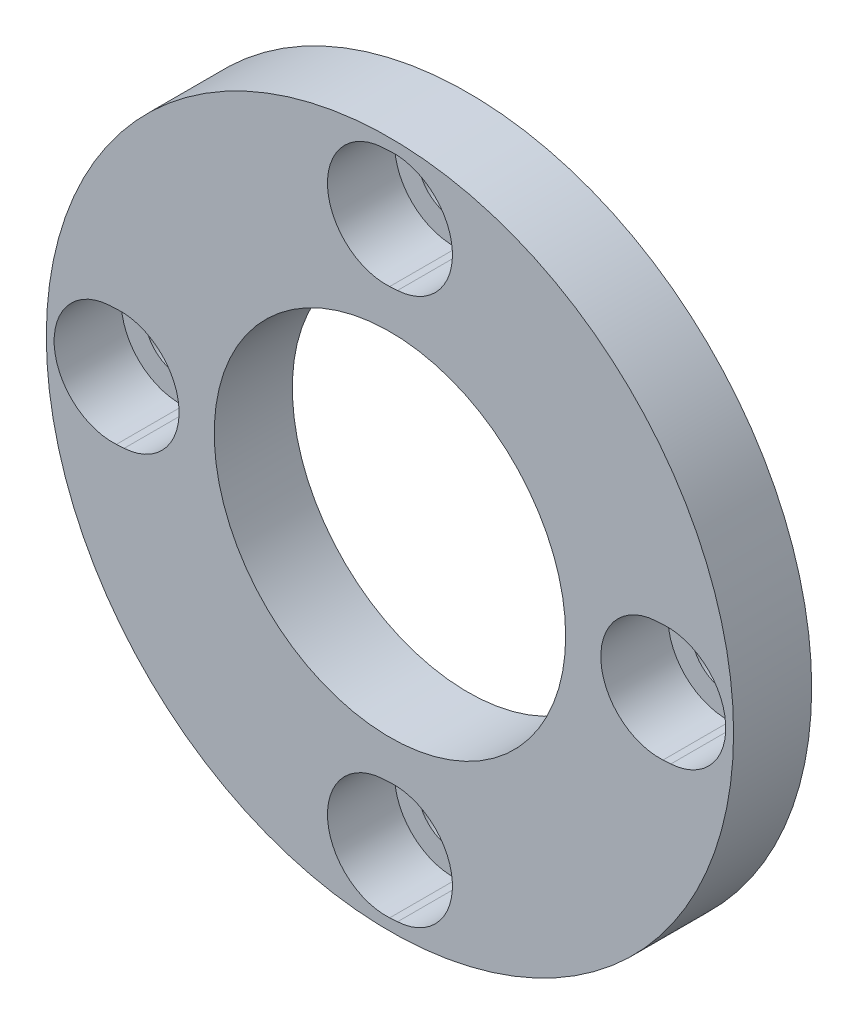
from build123d import *

# Parameters (mm, degrees)
IZIM1_R                                     = 44
IZIM1_R_2                                   = 22.5
Y_KSEKLIK_EKSTR_ZYON1_DEPTH                 = 10
M8_START                                    = 1.4
M8_ALT_GEN_ALYAN_BA_L_K_R_VIDA_IN_HAV_DEPTH = 8.6
M8_ALT_GEN_ALYAN_BA_L_K_R_VIDA_IN_3_DEPTH   = 1.4


# Read off the part's stored shape, not the designer's step: M8 Altıgen Alyan Başlı Kör Vida İçin Havşa1
with BuildPart() as part:
    # Çizim1 → Yükseklik-Ekstrüzyon1 (new body)
    with BuildSketch(Plane.XY):
        Circle(IZIM1_R)
        Circle(IZIM1_R_2, mode=Mode.SUBTRACT)
    extrude(amount=Y_KSEKLIK_EKSTR_ZYON1_DEPTH)

    # M8 Alt_gen Alyan Ba_l_ K_r Vida _in  2 → M8 Altıgen Alyan Başlı Kör Vida İçin Havşa1 (cut)
    with BuildSketch(Plane.XY.offset(M8_START)):
        with BuildLine():
            Line((-35.031641101, -7.516581593), (-34.033584774, -7.454263318))
            ThreePointArc((-34.033584774, -7.454263318), (-27.015549381, 0.4985462), (-34.968358899, 7.516581593))
            Line((-34.968358899, 7.516581593), (-35.966415226, 7.454263318))
            ThreePointArc((-35.966415226, 7.454263318), (-42.984450619, -0.4985462), (-35.031641101, -7.516581593))
        make_face()
        with BuildLine():
            Line((-0.031641101, -42.516581593), (0.966415226, -42.454263318))
            ThreePointArc((0.966415226, -42.454263318), (7.984450619, -34.5014538), (0.031641101, -27.483418407))
            Line((0.031641101, -27.483418407), (-0.966415226, -27.545736682))
            ThreePointArc((-0.966415226, -27.545736682), (-7.984450619, -35.4985462), (-0.031641101, -42.516581593))
        make_face()
        with BuildLine():
            Line((34.968358899, -7.516581593), (35.966415226, -7.454263318))
            ThreePointArc((35.966415226, -7.454263318), (42.984450619, 0.4985462), (35.031641101, 7.516581593))
            Line((35.031641101, 7.516581593), (34.033584774, 7.454263318))
            ThreePointArc((34.033584774, 7.454263318), (27.015549381, -0.4985462), (34.968358899, -7.516581593))
        make_face()
        with BuildLine():
            Line((-0.031641101, 27.483418407), (0.966415226, 27.545736682))
            ThreePointArc((0.966415226, 27.545736682), (7.984450619, 35.4985462), (0.031641101, 42.516581593))
            Line((0.031641101, 42.516581593), (-0.966415226, 42.454263318))
            ThreePointArc((-0.966415226, 42.454263318), (-7.984450619, 34.5014538), (-0.031641101, 27.483418407))
        make_face()
    extrude(amount=M8_ALT_GEN_ALYAN_BA_L_K_R_VIDA_IN_HAV_DEPTH, mode=Mode.SUBTRACT)

    # M8 Alt_gen Alyan Ba_l_ K_r Vida _in 3 ou → M8 Alt_gen Alyan Ba_l_ K_r Vida _in  3 (cut)
    with BuildSketch(Plane.XY):
        with BuildLine():
            Line((-35.218595926, -4.522412611), (-34.220539599, -4.460094336))
            ThreePointArc((-34.220539599, -4.460094336), (-30.009718363, 0.311591375), (-34.781404074, 4.522412611))
            Line((-34.781404074, 4.522412611), (-35.779460401, 4.460094336))
            ThreePointArc((-35.779460401, 4.460094336), (-39.990281637, -0.311591375), (-35.218595926, -4.522412611))
        make_face()
        with BuildLine():
            ThreePointArc((-0.779460401, -30.539905664), (-4.990281637, -35.311591375), (-0.218595926, -39.522412611))
            Line((-0.218595926, -39.522412611), (0.779460401, -39.460094336))
            ThreePointArc((0.779460401, -39.460094336), (4.990281637, -34.688408625), (0.218595926, -30.477587389))
            Line((0.218595926, -30.477587389), (-0.779460401, -30.539905664))
        make_face()
        with BuildLine():
            Line((34.781404074, -4.522412611), (35.779460401, -4.460094336))
            ThreePointArc((35.779460401, -4.460094336), (39.990281637, 0.311591375), (35.218595926, 4.522412611))
            Line((35.218595926, 4.522412611), (34.220539599, 4.460094336))
            ThreePointArc((34.220539599, 4.460094336), (30.009718363, -0.311591375), (34.781404074, -4.522412611))
        make_face()
        with BuildLine():
            ThreePointArc((0.779460401, 30.539905664), (4.990281637, 35.311591375), (0.218595926, 39.522412611))
            Line((0.218595926, 39.522412611), (-0.779460401, 39.460094336))
            ThreePointArc((-0.779460401, 39.460094336), (-4.990281637, 34.688408625), (-0.218595926, 30.477587389))
            Line((-0.218595926, 30.477587389), (0.779460401, 30.539905664))
        make_face()
    extrude(amount=M8_ALT_GEN_ALYAN_BA_L_K_R_VIDA_IN_3_DEPTH, mode=Mode.SUBTRACT)


solid = part.part
